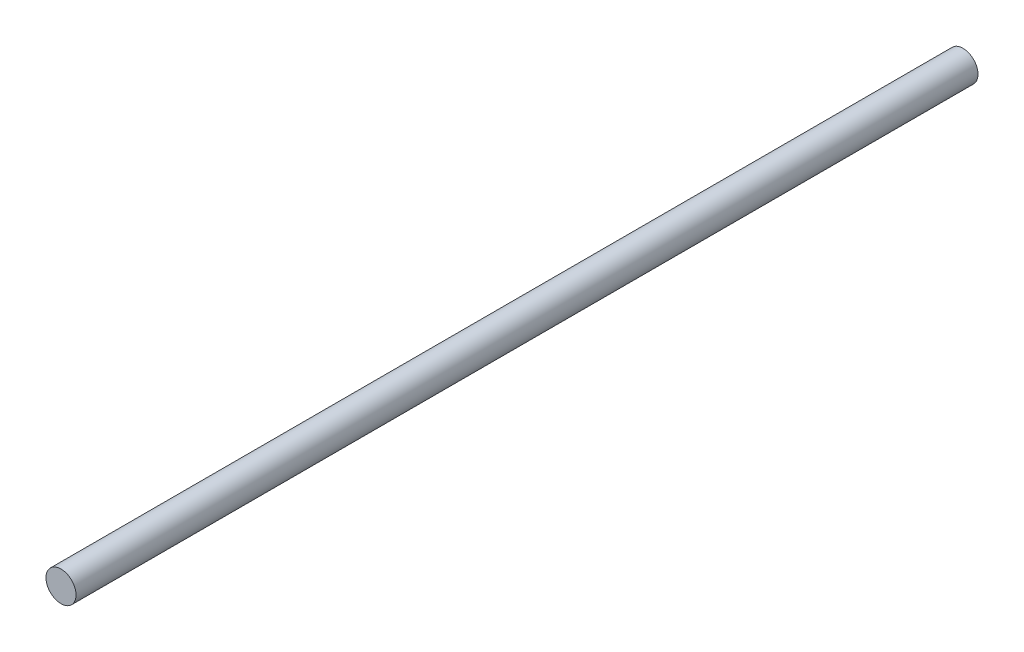
from build123d import *

# Parameters (mm, degrees)
SKETCH1_R           = 3.175
BOSS_EXTRUDE1_DEPTH = 190.5


with BuildPart() as part:
    # Sketch1 → Boss-Extrude1 (new body)
    with BuildSketch(Plane.XY):
        Circle(SKETCH1_R)
    extrude(amount=BOSS_EXTRUDE1_DEPTH)


solid = part.part
